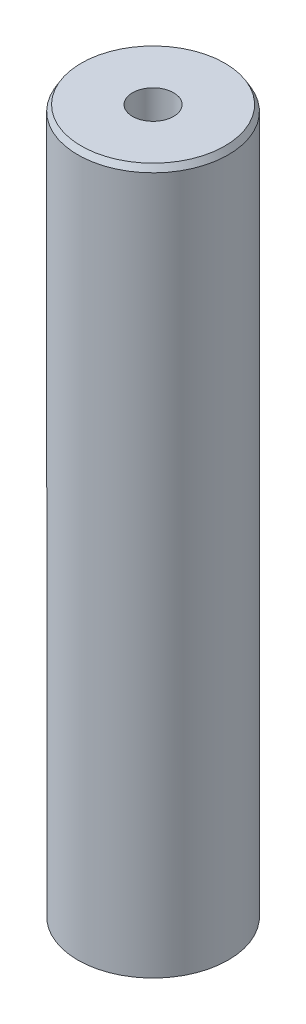
from build123d import *
from OCP.BRepFilletAPI import BRepFilletAPI_MakeChamfer

# Parameters (mm, degrees)
SKETCH1_R           = 17.5
BOSS_EXTRUDE1_DEPTH = 164.391410212
SKETCH2_R           = 4.780983019
CUT_EXTRUDE1_DEPTH  = 167.243904404
CHAMFER1_SIZE       = 1.380097031
CHAMFER1_SIZE2      = 0.796799392


with BuildPart() as part:
    # Sketch1 → Boss-Extrude1 (new body)
    with BuildSketch(Plane(origin=(0, 0, 0), x_dir=(1, 0, 0), z_dir=(0, 1, 0))):
        Circle(SKETCH1_R)
    extrude(amount=BOSS_EXTRUDE1_DEPTH)

    # Sketch2 → Cut-Extrude1 (cut, through all)
    with BuildSketch(Plane(origin=(0, 0, 0), x_dir=(1, 0, 0), z_dir=(0, 1, 0))):
        Circle(SKETCH2_R)
    extrude(amount=CUT_EXTRUDE1_DEPTH, mode=Mode.SUBTRACT)

    # Chamfer1: one chamfer whose edges measure the first distance from different faces: ONE call of the kernel's chamfer builder (chamfer() names one face for all edges)
    chamfer1_edges_1 = [part.edges().sort_by_distance(p)[0] for p in [
        (-17.5, 164.391410212, 0),
    ]]
    chamfer1_side_1 = [part.faces().sort_by_distance(p)[0] for p in [
        (-17.5, 82.195705106, 0),
    ]]
    chamfer1_edges_2 = [part.edges().sort_by_distance(p)[0] for p in [
        (-17.5, 0, 0),
    ]]
    chamfer1_side_2 = [part.faces().sort_by_distance(p)[0] for p in [
        (-17.005025253, 0, 0),
    ]]
    chamfer1 = BRepFilletAPI_MakeChamfer(part.part.solid().wrapped)
    for e in chamfer1_edges_1:
        chamfer1.Add(CHAMFER1_SIZE, CHAMFER1_SIZE2, e.wrapped, chamfer1_side_1[0].wrapped)  # the first distance lies on this face
    for e in chamfer1_edges_2:
        chamfer1.Add(CHAMFER1_SIZE, CHAMFER1_SIZE2, e.wrapped, chamfer1_side_2[0].wrapped)  # the first distance lies on this face
    add(Compound.cast(chamfer1.Shape()), mode=Mode.REPLACE)


solid = part.part
